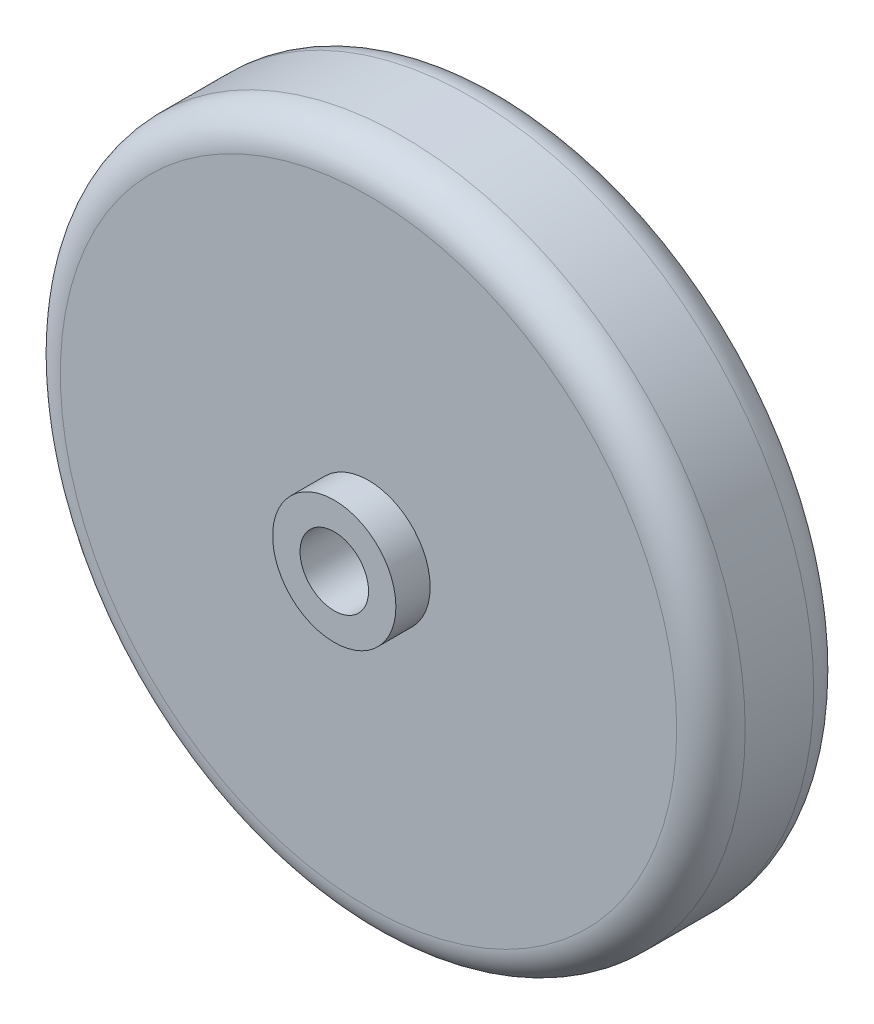
from build123d import *

# Parameters (mm, degrees)
SKETCH1_R           = 50
BOSS_EXTRUDE1_DEPTH = 20
SKETCH2_R           = 9
BOSS_EXTRUDE2_DEPTH = 5
CUT_EXTRUDE4_DEPTH  = 10
CHAMFER2_SIZE       = 2
FILLET1_R           = 5
SKETCH5_R           = 5
CUT_EXTRUDE5_DEPTH  = 15


with BuildPart() as part:
    # Sketch1 → Boss-Extrude1 (new body)
    with BuildSketch(Plane.XY):
        Circle(SKETCH1_R)
    extrude(amount=BOSS_EXTRUDE1_DEPTH)

    # Sketch2 → Boss-Extrude2 (add)
    with BuildSketch(Plane.XY.offset(20)):
        Circle(SKETCH2_R)
    extrude(amount=BOSS_EXTRUDE2_DEPTH)

    # Sketch3 → Cut-Extrude4 (cut)
    with BuildSketch(Plane(origin=(0, 0, 0), x_dir=(-1, 0, 0), z_dir=(0, 0, -1))):
        with BuildLine():
            Line((-36.97118964, 15.26863244), (-5.877852523, 8.090169944))
            Line((-5.877852523, 8.090169944), (-23.511410092, 32.360679775))
            ThreePointArc((-23.511410092, 32.360679775), (-31.425638229, 24.747308175), (-36.97118964, 15.26863244))
        make_face()
        with BuildLine():
            Line((-23.511410092, 32.360679775), (-5.877852523, 8.090169944))
            Line((-5.877852523, 8.090169944), (-3.096606476, 39.879957727))
            ThreePointArc((-3.096606476, 39.879957727), (-13.825032428, 37.534896808), (-23.511410092, 32.360679775))
        make_face()
        with BuildLine():
            Line((3.096606476, 39.879957727), (5.877852523, 8.090169944))
            Line((5.877852523, 8.090169944), (23.511410092, 32.360679775))
            ThreePointArc((23.511410092, 32.360679775), (13.825032428, 37.534896808), (3.096606476, 39.879957727))
        make_face()
        with BuildLine():
            Line((23.511410092, 32.360679775), (5.877852523, 8.090169944))
            Line((5.877852523, 8.090169944), (36.97118964, 15.26863244))
            ThreePointArc((36.97118964, 15.26863244), (31.425638229, 24.747308175), (23.511410092, 32.360679775))
        make_face()
        with BuildLine():
            Line((38.884997692, 9.378536905), (9.510565163, -3.090169944))
            Line((9.510565163, -3.090169944), (38.042260652, -12.360679775))
            ThreePointArc((38.042260652, -12.360679775), (39.507533624, -6.257378602), (40, 0))
            ThreePointArc((40, 0), (39.720271321, 4.722292468), (38.884997692, 9.378536905))
        make_face()
        with BuildLine():
            Line((38.042260652, -12.360679775), (9.510565163, -3.090169944))
            Line((9.510565163, -3.090169944), (25.946058278, -30.443423918))
            ThreePointArc((25.946058278, -30.443423918), (33.247144972, -22.240219226), (38.042260652, -12.360679775))
        make_face()
        with BuildLine():
            Line((20.93564375, -34.083703155), (0, -10))
            Line((0, -10), (0, -40))
            ThreePointArc((0, -40), (10.877772607, -38.492519573), (20.93564375, -34.083703155))
        make_face()
        with BuildLine():
            Line((0, -40), (0, -10))
            Line((0, -10), (-20.93564375, -34.083703155))
            ThreePointArc((-20.93564375, -34.083703155), (-10.877772607, -38.492519573), (0, -40))
        make_face()
        with BuildLine():
            Line((-25.946058278, -30.443423918), (-9.510565163, -3.090169944))
            Line((-9.510565163, -3.090169944), (-38.042260652, -12.360679775))
            ThreePointArc((-38.042260652, -12.360679775), (-33.247144972, -22.240219226), (-25.946058278, -30.443423918))
        make_face()
        with BuildLine():
            Line((-38.042260652, -12.360679775), (-9.510565163, -3.090169944))
            Line((-9.510565163, -3.090169944), (-38.884997692, 9.378536905))
            ThreePointArc((-38.884997692, 9.378536905), (-39.969978165, -1.549466183), (-38.042260652, -12.360679775))
        make_face()
    extrude(amount=-CUT_EXTRUDE4_DEPTH, mode=Mode.SUBTRACT)

    # Chamfer2
    chamfer2_edges = [part.edges().sort_by_distance(p)[0] for p in [
        (-24.197781428, 3.144183481, 0),
        (-17.728311721, -16.766796931, 0),
        (-4.487229499, 23.985063836, 0),
        (-21.424521082, 11.679401192, 0),
        (17.728311721, -16.766796931, 0),
        (24.197781428, 3.144183481, 0),
        (-10.467821875, -22.041851578, 0),
        (10.467821875, -22.041851578, 0),
        (21.424521082, 11.679401192, 0),
        (4.487229499, 23.985063836, 0),
    ]]
    chamfer(chamfer2_edges, length=CHAMFER2_SIZE)

    # Fillet1
    # the kernel refuses this fillet: 5 mm, written as the material it takes off along each edge
    with BuildSketch(Plane(origin=(0, 0, 0), x_dir=(0.33607060875046735, -0.9418367936824779, 0), z_dir=(-0.9418367936824779, -0.33607060875046735, 0))) as fillet1_piece_1_section:
        with BuildLine():
            CenterArc((40 + FILLET1_R, FILLET1_R), FILLET1_R, 180, 90)
            Line((40, FILLET1_R), (40, 0))
            Line((40, 0), (40 + FILLET1_R, 0))
        make_face()
    fillet1_piece_1 = revolve(axis=Axis((0, 0, 0), (0, 0, 1)), revolution_arc=104.724691482, mode=Mode.PRIVATE)
    fillet1_piece_1 = split(fillet1_piece_1, bisect_by=Plane(origin=(-4.951340344, -4.304134495, 0), z_dir=(-0.7547095802227719, -0.6560590289905075, 0)), keep=Keep.TOP, mode=Mode.PRIVATE)
    add(fillet1_piece_1, mode=Mode.SUBTRACT)
    with BuildSketch(Plane(origin=(0, 0, 0), x_dir=(0.33607060875046735, -0.9418367936824779, 0), z_dir=(-0.9418367936824779, -0.33607060875046735, 0))) as fillet1_piece_2_section:
        with BuildLine():
            CenterArc((40 + FILLET1_R, FILLET1_R), FILLET1_R, 180, 90)
            Line((40, FILLET1_R), (40, 0))
            Line((40, 0), (40 + FILLET1_R, 0))
        make_face()
    fillet1_piece_2 = revolve(axis=Axis((0, 0, 0), (0, 0, 1)), revolution_arc=104.724691482, mode=Mode.PRIVATE)
    fillet1_piece_2 = split(fillet1_piece_2, bisect_by=Plane(origin=(-1.720960592, -1.496008219, -2.280295145), z_dir=(-0.5336602620019746, -0.4639037882578497, -0.7071067811865477)), keep=Keep.TOP, mode=Mode.PRIVATE)
    add(fillet1_piece_2, mode=Mode.SUBTRACT)
    with BuildSketch(Plane(origin=(0, 0, 0), x_dir=(0.33607060875046735, -0.9418367936824779, 0), z_dir=(-0.9418367936824779, -0.33607060875046735, 0))) as fillet1_piece_3_section:
        with BuildLine():
            CenterArc((40 + FILLET1_R, FILLET1_R), FILLET1_R, 180, 90)
            Line((40, FILLET1_R), (40, 0))
            Line((40, 0), (40 + FILLET1_R, 0))
        make_face()
    fillet1_piece_3 = revolve(axis=Axis((0, 0, 0), (0, 0, 1)), revolution_arc=104.724691482, mode=Mode.PRIVATE)
    fillet1_piece_3 = split(fillet1_piece_3, bisect_by=Plane(origin=(2.563426848, -6.039055203, 0), z_dir=(0.3907311284892775, -0.9205048534524388, 0)), keep=Keep.TOP, mode=Mode.PRIVATE)
    fillet1_piece_3 = split(fillet1_piece_3, bisect_by=Plane(origin=(5.62352347, 3.378953793, 0), z_dir=(0.8571673007021122, 0.5150380749100543, 0)), keep=Keep.TOP, mode=Mode.PRIVATE)
    add(fillet1_piece_3, mode=Mode.SUBTRACT)
    with BuildSketch(Plane(origin=(0, 0, 0), x_dir=(0.33607060875046735, -0.9418367936824779, 0), z_dir=(-0.9418367936824779, -0.33607060875046735, 0))) as fillet1_piece_4_section:
        with BuildLine():
            CenterArc((40 + FILLET1_R, FILLET1_R), FILLET1_R, 180, 90)
            Line((40, FILLET1_R), (40, 0))
            Line((40, 0), (40 + FILLET1_R, 0))
        make_face()
    fillet1_piece_4 = revolve(axis=Axis((0, 0, 0), (0, 0, 1)), revolution_arc=104.724691482, mode=Mode.PRIVATE)
    fillet1_piece_4 = split(fillet1_piece_4, bisect_by=Plane(origin=(0.890982295, -2.099022748, -2.280295145), z_dir=(0.2762886305754404, -0.6508952239913486, -0.7071067811865477)), keep=Keep.TOP, mode=Mode.PRIVATE)
    fillet1_piece_4 = split(fillet1_piece_4, bisect_by=Plane(origin=(1.954594434, 1.174438822, -2.280295145), z_dir=(0.6061088109378321, 0.36418691533816455, -0.7071067811865476)), keep=Keep.TOP, mode=Mode.PRIVATE)
    add(fillet1_piece_4, mode=Mode.SUBTRACT)
    with BuildSketch(Plane(origin=(0, 0, 0), x_dir=(0.33607060875046735, -0.9418367936824779, 0), z_dir=(-0.9418367936824779, -0.33607060875046735, 0))) as fillet1_piece_5_section:
        with BuildLine():
            CenterArc((40 + FILLET1_R, FILLET1_R), FILLET1_R, 180, 90)
            Line((40, FILLET1_R), (40, 0))
            Line((40, 0), (40 + FILLET1_R, 0))
        make_face()
    fillet1_piece_5 = revolve(axis=Axis((0, 0, 0), (0, 0, 1)), revolution_arc=104.724691482, mode=Mode.PRIVATE)
    fillet1_piece_5 = split(fillet1_piece_5, bisect_by=Plane(origin=(-1.475811703, 6.392442786, 0), z_dir=(-0.22495105434386392, 0.9743700647852355, 0)), keep=Keep.TOP, mode=Mode.PRIVATE)
    add(fillet1_piece_5, mode=Mode.SUBTRACT)
    with BuildSketch(Plane(origin=(0, 0, 0), x_dir=(0.33607060875046735, -0.9418367936824779, 0), z_dir=(-0.9418367936824779, -0.33607060875046735, 0))) as fillet1_piece_6_section:
        with BuildLine():
            CenterArc((40 + FILLET1_R, FILLET1_R), FILLET1_R, 180, 90)
            Line((40, FILLET1_R), (40, 0))
            Line((40, 0), (40 + FILLET1_R, 0))
        make_face()
    fillet1_piece_6 = revolve(axis=Axis((0, 0, 0), (0, 0, 1)), revolution_arc=104.724691482, mode=Mode.PRIVATE)
    fillet1_piece_6 = split(fillet1_piece_6, bisect_by=Plane(origin=(-0.512954797, 2.221851328, -2.280295145), z_dir=(-0.15906441596160978, 0.6889836801948155, -0.7071067811865477)), keep=Keep.TOP, mode=Mode.PRIVATE)
    add(fillet1_piece_6, mode=Mode.SUBTRACT)
    with BuildSketch(Plane(origin=(0, 0, 0), x_dir=(-0.7918884905044262, -0.610665717562908, 0), z_dir=(-0.610665717562908, 0.7918884905044262, 0))) as fillet1_piece_7_section:
        with BuildLine():
            CenterArc((40 + FILLET1_R, FILLET1_R), FILLET1_R, 180, 90)
            Line((40, FILLET1_R), (40, 0))
            Line((40, 0), (40 + FILLET1_R, 0))
        make_face()
    fillet1_piece_7 = revolve(axis=Axis((0, 0, 0), (0, 0, 1)), revolution_arc=104.724691482, mode=Mode.PRIVATE)
    fillet1_piece_7 = split(fillet1_piece_7, bisect_by=Plane(origin=(-5.62352347, 3.378953793, 0), z_dir=(-0.8571673007021121, 0.5150380749100545, 0)), keep=Keep.TOP, mode=Mode.PRIVATE)
    add(fillet1_piece_7, mode=Mode.SUBTRACT)
    with BuildSketch(Plane(origin=(0, 0, 0), x_dir=(-0.7918884905044262, -0.610665717562908, 0), z_dir=(-0.610665717562908, 0.7918884905044262, 0))) as fillet1_piece_8_section:
        with BuildLine():
            CenterArc((40 + FILLET1_R, FILLET1_R), FILLET1_R, 180, 90)
            Line((40, FILLET1_R), (40, 0))
            Line((40, 0), (40 + FILLET1_R, 0))
        make_face()
    fillet1_piece_8 = revolve(axis=Axis((0, 0, 0), (0, 0, 1)), revolution_arc=104.724691482, mode=Mode.PRIVATE)
    fillet1_piece_8 = split(fillet1_piece_8, bisect_by=Plane(origin=(-1.954594434, 1.174438822, -2.280295145), z_dir=(-0.6061088109378319, 0.3641869153381646, -0.7071067811865477)), keep=Keep.TOP, mode=Mode.PRIVATE)
    add(fillet1_piece_8, mode=Mode.SUBTRACT)
    with BuildSketch(Plane(origin=(0, 0, 0), x_dir=(-0.7918884905044262, -0.610665717562908, 0), z_dir=(-0.610665717562908, 0.7918884905044262, 0))) as fillet1_piece_9_section:
        with BuildLine():
            CenterArc((40 + FILLET1_R, FILLET1_R), FILLET1_R, 180, 90)
            Line((40, FILLET1_R), (40, 0))
            Line((40, 0), (40 + FILLET1_R, 0))
        make_face()
    fillet1_piece_9 = revolve(axis=Axis((0, 0, 0), (0, 0, 1)), revolution_arc=104.724691482, mode=Mode.PRIVATE)
    fillet1_piece_9 = split(fillet1_piece_9, bisect_by=Plane(origin=(-4.951340344, -4.304134495, 0), z_dir=(-0.7547095802227719, -0.6560590289905075, 0)), keep=Keep.TOP, mode=Mode.PRIVATE)
    fillet1_piece_9 = split(fillet1_piece_9, bisect_by=Plane(origin=(4.951340344, -4.304134495, 0), z_dir=(0.7547095802227719, -0.6560590289905074, 0)), keep=Keep.TOP, mode=Mode.PRIVATE)
    add(fillet1_piece_9, mode=Mode.SUBTRACT)
    with BuildSketch(Plane(origin=(0, 0, 0), x_dir=(-0.7918884905044262, -0.610665717562908, 0), z_dir=(-0.610665717562908, 0.7918884905044262, 0))) as fillet1_piece_10_section:
        with BuildLine():
            CenterArc((40 + FILLET1_R, FILLET1_R), FILLET1_R, 180, 90)
            Line((40, FILLET1_R), (40, 0))
            Line((40, 0), (40 + FILLET1_R, 0))
        make_face()
    fillet1_piece_10 = revolve(axis=Axis((0, 0, 0), (0, 0, 1)), revolution_arc=104.724691482, mode=Mode.PRIVATE)
    fillet1_piece_10 = split(fillet1_piece_10, bisect_by=Plane(origin=(-1.720960592, -1.496008219, -2.280295145), z_dir=(-0.5336602620019746, -0.4639037882578497, -0.7071067811865477)), keep=Keep.TOP, mode=Mode.PRIVATE)
    fillet1_piece_10 = split(fillet1_piece_10, bisect_by=Plane(origin=(1.720960592, -1.496008219, -2.280295145), z_dir=(0.5336602620019747, -0.46390378825784945, -0.7071067811865477)), keep=Keep.TOP, mode=Mode.PRIVATE)
    add(fillet1_piece_10, mode=Mode.SUBTRACT)
    with BuildSketch(Plane(origin=(0, 0, 0), x_dir=(-0.7918884905044262, -0.610665717562908, 0), z_dir=(-0.610665717562908, 0.7918884905044262, 0))) as fillet1_piece_11_section:
        with BuildLine():
            CenterArc((40 + FILLET1_R, FILLET1_R), FILLET1_R, 180, 90)
            Line((40, FILLET1_R), (40, 0))
            Line((40, 0), (40 + FILLET1_R, 0))
        make_face()
    fillet1_piece_11 = revolve(axis=Axis((0, 0, 0), (0, 0, 1)), revolution_arc=104.724691482, mode=Mode.PRIVATE)
    fillet1_piece_11 = split(fillet1_piece_11, bisect_by=Plane(origin=(5.62352347, 3.378953793, 0), z_dir=(0.8571673007021122, 0.5150380749100543, 0)), keep=Keep.TOP, mode=Mode.PRIVATE)
    add(fillet1_piece_11, mode=Mode.SUBTRACT)
    with BuildSketch(Plane(origin=(0, 0, 0), x_dir=(-0.7918884905044262, -0.610665717562908, 0), z_dir=(-0.610665717562908, 0.7918884905044262, 0))) as fillet1_piece_12_section:
        with BuildLine():
            CenterArc((40 + FILLET1_R, FILLET1_R), FILLET1_R, 180, 90)
            Line((40, FILLET1_R), (40, 0))
            Line((40, 0), (40 + FILLET1_R, 0))
        make_face()
    fillet1_piece_12 = revolve(axis=Axis((0, 0, 0), (0, 0, 1)), revolution_arc=104.724691482, mode=Mode.PRIVATE)
    fillet1_piece_12 = split(fillet1_piece_12, bisect_by=Plane(origin=(1.954594434, 1.174438822, -2.280295145), z_dir=(0.6061088109378321, 0.36418691533816455, -0.7071067811865476)), keep=Keep.TOP, mode=Mode.PRIVATE)
    add(fillet1_piece_12, mode=Mode.SUBTRACT)
    with BuildSketch(Plane(origin=(0, 0, 0), x_dir=(-0.8254846111820394, 0.5644246244642743, 0), z_dir=(0.5644246244642743, 0.8254846111820394, 0))) as fillet1_piece_13_section:
        with BuildLine():
            CenterArc((40 + FILLET1_R, FILLET1_R), FILLET1_R, 180, 90)
            Line((40, FILLET1_R), (40, 0))
            Line((40, 0), (40 + FILLET1_R, 0))
        make_face()
    fillet1_piece_13 = revolve(axis=Axis((0, 0, 0), (0, 0, 1)), revolution_arc=104.724691482, mode=Mode.PRIVATE)
    fillet1_piece_13 = split(fillet1_piece_13, bisect_by=Plane(origin=(1.475811703, 6.392442786, 0), z_dir=(0.2249510543438882, 0.9743700647852299, 0)), keep=Keep.TOP, mode=Mode.PRIVATE)
    add(fillet1_piece_13, mode=Mode.SUBTRACT)
    with BuildSketch(Plane(origin=(0, 0, 0), x_dir=(-0.8254846111820394, 0.5644246244642743, 0), z_dir=(0.5644246244642743, 0.8254846111820394, 0))) as fillet1_piece_14_section:
        with BuildLine():
            CenterArc((40 + FILLET1_R, FILLET1_R), FILLET1_R, 180, 90)
            Line((40, FILLET1_R), (40, 0))
            Line((40, 0), (40 + FILLET1_R, 0))
        make_face()
    fillet1_piece_14 = revolve(axis=Axis((0, 0, 0), (0, 0, 1)), revolution_arc=104.724691482, mode=Mode.PRIVATE)
    fillet1_piece_14 = split(fillet1_piece_14, bisect_by=Plane(origin=(0.512954797, 2.221851328, -2.280295145), z_dir=(0.15906441596162676, 0.6889836801948115, -0.7071067811865477)), keep=Keep.TOP, mode=Mode.PRIVATE)
    add(fillet1_piece_14, mode=Mode.SUBTRACT)
    with BuildSketch(Plane(origin=(0, 0, 0), x_dir=(-0.8254846111820394, 0.5644246244642743, 0), z_dir=(0.5644246244642743, 0.8254846111820394, 0))) as fillet1_piece_15_section:
        with BuildLine():
            CenterArc((40 + FILLET1_R, FILLET1_R), FILLET1_R, 180, 90)
            Line((40, FILLET1_R), (40, 0))
            Line((40, 0), (40 + FILLET1_R, 0))
        make_face()
    fillet1_piece_15 = revolve(axis=Axis((0, 0, 0), (0, 0, 1)), revolution_arc=104.724691482, mode=Mode.PRIVATE)
    fillet1_piece_15 = split(fillet1_piece_15, bisect_by=Plane(origin=(-5.62352347, 3.378953793, 0), z_dir=(-0.8571673007021121, 0.5150380749100545, 0)), keep=Keep.TOP, mode=Mode.PRIVATE)
    fillet1_piece_15 = split(fillet1_piece_15, bisect_by=Plane(origin=(-2.563426848, -6.039055203, 0), z_dir=(-0.39073112848929537, -0.9205048534524312, 0)), keep=Keep.TOP, mode=Mode.PRIVATE)
    add(fillet1_piece_15, mode=Mode.SUBTRACT)
    with BuildSketch(Plane(origin=(0, 0, 0), x_dir=(-0.8254846111820394, 0.5644246244642743, 0), z_dir=(0.5644246244642743, 0.8254846111820394, 0))) as fillet1_piece_16_section:
        with BuildLine():
            CenterArc((40 + FILLET1_R, FILLET1_R), FILLET1_R, 180, 90)
            Line((40, FILLET1_R), (40, 0))
            Line((40, 0), (40 + FILLET1_R, 0))
        make_face()
    fillet1_piece_16 = revolve(axis=Axis((0, 0, 0), (0, 0, 1)), revolution_arc=104.724691482, mode=Mode.PRIVATE)
    fillet1_piece_16 = split(fillet1_piece_16, bisect_by=Plane(origin=(-1.954594434, 1.174438822, -2.280295145), z_dir=(-0.6061088109378319, 0.3641869153381646, -0.7071067811865477)), keep=Keep.TOP, mode=Mode.PRIVATE)
    fillet1_piece_16 = split(fillet1_piece_16, bisect_by=Plane(origin=(-0.890982295, -2.099022748, -2.280295145), z_dir=(-0.2762886305754528, -0.650895223991343, -0.7071067811865479)), keep=Keep.TOP, mode=Mode.PRIVATE)
    add(fillet1_piece_16, mode=Mode.SUBTRACT)
    with BuildSketch(Plane(origin=(0, 0, 0), x_dir=(-0.8254846111820394, 0.5644246244642743, 0), z_dir=(0.5644246244642743, 0.8254846111820394, 0))) as fillet1_piece_17_section:
        with BuildLine():
            CenterArc((40 + FILLET1_R, FILLET1_R), FILLET1_R, 180, 90)
            Line((40, FILLET1_R), (40, 0))
            Line((40, 0), (40 + FILLET1_R, 0))
        make_face()
    fillet1_piece_17 = revolve(axis=Axis((0, 0, 0), (0, 0, 1)), revolution_arc=104.724691482, mode=Mode.PRIVATE)
    fillet1_piece_17 = split(fillet1_piece_17, bisect_by=Plane(origin=(4.951340344, -4.304134495, 0), z_dir=(0.7547095802227719, -0.6560590289905074, 0)), keep=Keep.TOP, mode=Mode.PRIVATE)
    add(fillet1_piece_17, mode=Mode.SUBTRACT)
    with BuildSketch(Plane(origin=(0, 0, 0), x_dir=(-0.8254846111820394, 0.5644246244642743, 0), z_dir=(0.5644246244642743, 0.8254846111820394, 0))) as fillet1_piece_18_section:
        with BuildLine():
            CenterArc((40 + FILLET1_R, FILLET1_R), FILLET1_R, 180, 90)
            Line((40, FILLET1_R), (40, 0))
            Line((40, 0), (40 + FILLET1_R, 0))
        make_face()
    fillet1_piece_18 = revolve(axis=Axis((0, 0, 0), (0, 0, 1)), revolution_arc=104.724691482, mode=Mode.PRIVATE)
    fillet1_piece_18 = split(fillet1_piece_18, bisect_by=Plane(origin=(1.720960592, -1.496008219, -2.280295145), z_dir=(0.5336602620019747, -0.46390378825784945, -0.7071067811865477)), keep=Keep.TOP, mode=Mode.PRIVATE)
    add(fillet1_piece_18, mode=Mode.SUBTRACT)
    with BuildSketch(Plane(origin=(0, 0, 0), x_dir=(0.2817109436039243, 0.959499319569215, 0), z_dir=(0.959499319569215, -0.2817109436039243, 0))) as fillet1_piece_19_section:
        with BuildLine():
            CenterArc((40 + FILLET1_R, FILLET1_R), FILLET1_R, 180, 90)
            Line((40, FILLET1_R), (40, 0))
            Line((40, 0), (40 + FILLET1_R, 0))
        make_face()
    fillet1_piece_19 = revolve(axis=Axis((0, 0, 0), (0, 0, 1)), revolution_arc=104.724691482, mode=Mode.PRIVATE)
    fillet1_piece_19 = split(fillet1_piece_19, bisect_by=Plane(origin=(6.535625263, 0.57179312, 0), z_dir=(0.9961946980917454, 0.08715574274765994, 0)), keep=Keep.TOP, mode=Mode.PRIVATE)
    add(fillet1_piece_19, mode=Mode.SUBTRACT)
    with BuildSketch(Plane(origin=(0, 0, 0), x_dir=(0.2817109436039243, 0.959499319569215, 0), z_dir=(0.959499319569215, -0.2817109436039243, 0))) as fillet1_piece_20_section:
        with BuildLine():
            CenterArc((40 + FILLET1_R, FILLET1_R), FILLET1_R, 180, 90)
            Line((40, FILLET1_R), (40, 0))
            Line((40, 0), (40 + FILLET1_R, 0))
        make_face()
    fillet1_piece_20 = revolve(axis=Axis((0, 0, 0), (0, 0, 1)), revolution_arc=104.724691482, mode=Mode.PRIVATE)
    fillet1_piece_20 = split(fillet1_piece_20, bisect_by=Plane(origin=(2.271617933, 0.198740817, -2.280295145), z_dir=(0.7044160264027587, 0.0616284167162206, -0.7071067811865476)), keep=Keep.TOP, mode=Mode.PRIVATE)
    add(fillet1_piece_20, mode=Mode.SUBTRACT)
    with BuildSketch(Plane(origin=(0, 0, 0), x_dir=(0.2817109436039243, 0.959499319569215, 0), z_dir=(0.959499319569215, -0.2817109436039243, 0))) as fillet1_piece_21_section:
        with BuildLine():
            CenterArc((40 + FILLET1_R, FILLET1_R), FILLET1_R, 180, 90)
            Line((40, FILLET1_R), (40, 0))
            Line((40, 0), (40 + FILLET1_R, 0))
        make_face()
    fillet1_piece_21 = revolve(axis=Axis((0, 0, 0), (0, 0, 1)), revolution_arc=104.724691482, mode=Mode.PRIVATE)
    fillet1_piece_21 = split(fillet1_piece_21, bisect_by=Plane(origin=(1.475811703, 6.392442786, 0), z_dir=(0.2249510543438882, 0.9743700647852299, 0)), keep=Keep.TOP, mode=Mode.PRIVATE)
    fillet1_piece_21 = split(fillet1_piece_21, bisect_by=Plane(origin=(-6.535625263, 0.57179312, 0), z_dir=(-0.9961946980917457, 0.08715574274765678, 0)), keep=Keep.TOP, mode=Mode.PRIVATE)
    add(fillet1_piece_21, mode=Mode.SUBTRACT)
    with BuildSketch(Plane(origin=(0, 0, 0), x_dir=(0.2817109436039243, 0.959499319569215, 0), z_dir=(0.959499319569215, -0.2817109436039243, 0))) as fillet1_piece_22_section:
        with BuildLine():
            CenterArc((40 + FILLET1_R, FILLET1_R), FILLET1_R, 180, 90)
            Line((40, FILLET1_R), (40, 0))
            Line((40, 0), (40 + FILLET1_R, 0))
        make_face()
    fillet1_piece_22 = revolve(axis=Axis((0, 0, 0), (0, 0, 1)), revolution_arc=104.724691482, mode=Mode.PRIVATE)
    fillet1_piece_22 = split(fillet1_piece_22, bisect_by=Plane(origin=(0.512954797, 2.221851328, -2.280295145), z_dir=(0.15906441596162676, 0.6889836801948115, -0.7071067811865477)), keep=Keep.TOP, mode=Mode.PRIVATE)
    fillet1_piece_22 = split(fillet1_piece_22, bisect_by=Plane(origin=(-2.271617933, 0.198740817, -2.280295145), z_dir=(-0.7044160264027588, 0.06162841671621832, -0.7071067811865476)), keep=Keep.TOP, mode=Mode.PRIVATE)
    add(fillet1_piece_22, mode=Mode.SUBTRACT)
    with BuildSketch(Plane(origin=(0, 0, 0), x_dir=(0.2817109436039243, 0.959499319569215, 0), z_dir=(0.959499319569215, -0.2817109436039243, 0))) as fillet1_piece_23_section:
        with BuildLine():
            CenterArc((40 + FILLET1_R, FILLET1_R), FILLET1_R, 180, 90)
            Line((40, FILLET1_R), (40, 0))
            Line((40, 0), (40 + FILLET1_R, 0))
        make_face()
    fillet1_piece_23 = revolve(axis=Axis((0, 0, 0), (0, 0, 1)), revolution_arc=104.724691482, mode=Mode.PRIVATE)
    fillet1_piece_23 = split(fillet1_piece_23, bisect_by=Plane(origin=(-2.563426848, -6.039055203, 0), z_dir=(-0.39073112848929537, -0.9205048534524312, 0)), keep=Keep.TOP, mode=Mode.PRIVATE)
    add(fillet1_piece_23, mode=Mode.SUBTRACT)
    with BuildSketch(Plane(origin=(0, 0, 0), x_dir=(0.2817109436039243, 0.959499319569215, 0), z_dir=(0.959499319569215, -0.2817109436039243, 0))) as fillet1_piece_24_section:
        with BuildLine():
            CenterArc((40 + FILLET1_R, FILLET1_R), FILLET1_R, 180, 90)
            Line((40, FILLET1_R), (40, 0))
            Line((40, 0), (40 + FILLET1_R, 0))
        make_face()
    fillet1_piece_24 = revolve(axis=Axis((0, 0, 0), (0, 0, 1)), revolution_arc=104.724691482, mode=Mode.PRIVATE)
    fillet1_piece_24 = split(fillet1_piece_24, bisect_by=Plane(origin=(-0.890982295, -2.099022748, -2.280295145), z_dir=(-0.2762886305754528, -0.650895223991343, -0.7071067811865479)), keep=Keep.TOP, mode=Mode.PRIVATE)
    add(fillet1_piece_24, mode=Mode.SUBTRACT)
    with BuildSketch(Plane(origin=(0, 0, 0), x_dir=(0.9995915493320829, 0.028578567211915915, 0), z_dir=(0.028578567211915915, -0.9995915493320829, 0))) as fillet1_piece_25_section:
        with BuildLine():
            CenterArc((40 + FILLET1_R, FILLET1_R), FILLET1_R, 180, 90)
            Line((40, FILLET1_R), (40, 0))
            Line((40, 0), (40 + FILLET1_R, 0))
        make_face()
    fillet1_piece_25 = revolve(axis=Axis((0, 0, 0), (0, 0, 1)), revolution_arc=104.724691482, mode=Mode.PRIVATE)
    fillet1_piece_25 = split(fillet1_piece_25, bisect_by=Plane(origin=(2.563426848, -6.039055203, 0), z_dir=(0.3907311284892775, -0.9205048534524388, 0)), keep=Keep.TOP, mode=Mode.PRIVATE)
    add(fillet1_piece_25, mode=Mode.SUBTRACT)
    with BuildSketch(Plane(origin=(0, 0, 0), x_dir=(0.9995915493320829, 0.028578567211915915, 0), z_dir=(0.028578567211915915, -0.9995915493320829, 0))) as fillet1_piece_26_section:
        with BuildLine():
            CenterArc((40 + FILLET1_R, FILLET1_R), FILLET1_R, 180, 90)
            Line((40, FILLET1_R), (40, 0))
            Line((40, 0), (40 + FILLET1_R, 0))
        make_face()
    fillet1_piece_26 = revolve(axis=Axis((0, 0, 0), (0, 0, 1)), revolution_arc=104.724691482, mode=Mode.PRIVATE)
    fillet1_piece_26 = split(fillet1_piece_26, bisect_by=Plane(origin=(0.890982295, -2.099022748, -2.280295145), z_dir=(0.2762886305754404, -0.6508952239913486, -0.7071067811865477)), keep=Keep.TOP, mode=Mode.PRIVATE)
    add(fillet1_piece_26, mode=Mode.SUBTRACT)
    with BuildSketch(Plane(origin=(0, 0, 0), x_dir=(0.9995915493320829, 0.028578567211915915, 0), z_dir=(0.028578567211915915, -0.9995915493320829, 0))) as fillet1_piece_27_section:
        with BuildLine():
            CenterArc((40 + FILLET1_R, FILLET1_R), FILLET1_R, 180, 90)
            Line((40, FILLET1_R), (40, 0))
            Line((40, 0), (40 + FILLET1_R, 0))
        make_face()
    fillet1_piece_27 = revolve(axis=Axis((0, 0, 0), (0, 0, 1)), revolution_arc=104.724691482, mode=Mode.PRIVATE)
    fillet1_piece_27 = split(fillet1_piece_27, bisect_by=Plane(origin=(6.535625263, 0.57179312, 0), z_dir=(0.9961946980917454, 0.08715574274765994, 0)), keep=Keep.TOP, mode=Mode.PRIVATE)
    fillet1_piece_27 = split(fillet1_piece_27, bisect_by=Plane(origin=(-1.475811703, 6.392442786, 0), z_dir=(-0.22495105434386392, 0.9743700647852355, 0)), keep=Keep.TOP, mode=Mode.PRIVATE)
    add(fillet1_piece_27, mode=Mode.SUBTRACT)
    with BuildSketch(Plane(origin=(0, 0, 0), x_dir=(0.9995915493320829, 0.028578567211915915, 0), z_dir=(0.028578567211915915, -0.9995915493320829, 0))) as fillet1_piece_28_section:
        with BuildLine():
            CenterArc((40 + FILLET1_R, FILLET1_R), FILLET1_R, 180, 90)
            Line((40, FILLET1_R), (40, 0))
            Line((40, 0), (40 + FILLET1_R, 0))
        make_face()
    fillet1_piece_28 = revolve(axis=Axis((0, 0, 0), (0, 0, 1)), revolution_arc=104.724691482, mode=Mode.PRIVATE)
    fillet1_piece_28 = split(fillet1_piece_28, bisect_by=Plane(origin=(2.271617933, 0.198740817, -2.280295145), z_dir=(0.7044160264027587, 0.0616284167162206, -0.7071067811865476)), keep=Keep.TOP, mode=Mode.PRIVATE)
    fillet1_piece_28 = split(fillet1_piece_28, bisect_by=Plane(origin=(-0.512954797, 2.221851328, -2.280295145), z_dir=(-0.15906441596160978, 0.6889836801948155, -0.7071067811865477)), keep=Keep.TOP, mode=Mode.PRIVATE)
    add(fillet1_piece_28, mode=Mode.SUBTRACT)
    with BuildSketch(Plane(origin=(0, 0, 0), x_dir=(0.9995915493320829, 0.028578567211915915, 0), z_dir=(0.028578567211915915, -0.9995915493320829, 0))) as fillet1_piece_29_section:
        with BuildLine():
            CenterArc((40 + FILLET1_R, FILLET1_R), FILLET1_R, 180, 90)
            Line((40, FILLET1_R), (40, 0))
            Line((40, 0), (40 + FILLET1_R, 0))
        make_face()
    fillet1_piece_29 = revolve(axis=Axis((0, 0, 0), (0, 0, 1)), revolution_arc=104.724691482, mode=Mode.PRIVATE)
    fillet1_piece_29 = split(fillet1_piece_29, bisect_by=Plane(origin=(-6.535625263, 0.57179312, 0), z_dir=(-0.9961946980917457, 0.08715574274765678, 0)), keep=Keep.TOP, mode=Mode.PRIVATE)
    add(fillet1_piece_29, mode=Mode.SUBTRACT)
    with BuildSketch(Plane(origin=(0, 0, 0), x_dir=(0.9995915493320829, 0.028578567211915915, 0), z_dir=(0.028578567211915915, -0.9995915493320829, 0))) as fillet1_piece_30_section:
        with BuildLine():
            CenterArc((40 + FILLET1_R, FILLET1_R), FILLET1_R, 180, 90)
            Line((40, FILLET1_R), (40, 0))
            Line((40, 0), (40 + FILLET1_R, 0))
        make_face()
    fillet1_piece_30 = revolve(axis=Axis((0, 0, 0), (0, 0, 1)), revolution_arc=104.724691482, mode=Mode.PRIVATE)
    fillet1_piece_30 = split(fillet1_piece_30, bisect_by=Plane(origin=(-2.271617933, 0.198740817, -2.280295145), z_dir=(-0.7044160264027588, 0.06162841671621832, -0.7071067811865476)), keep=Keep.TOP, mode=Mode.PRIVATE)
    add(fillet1_piece_30, mode=Mode.SUBTRACT)

    # Fillet2: read off the stored shape, not the designer's step
    # Fillet2 outline → Fillet2 (revolve, cut)
    with BuildSketch(Plane.XZ):
        with BuildLine():
            ThreePointArc((50, 5), (48.535533906, 1.464466094), (45, 0))
            Line((45, 0), (50, 0))
            Line((50, 0), (50, 5))
        make_face()
        with BuildLine():
            ThreePointArc((45, 20), (48.535533906, 18.535533906), (50, 15))
            Line((50, 15), (50, 20))
            Line((50, 20), (45, 20))
        make_face()
    revolve(axis=Axis((0, 0, 0), (0, 0, 1)), mode=Mode.SUBTRACT)

    # Sketch5 → Cut-Extrude5 (cut)
    with BuildSketch(Plane.XY.offset(25)):
        Circle(SKETCH5_R)
    extrude(amount=-CUT_EXTRUDE5_DEPTH, mode=Mode.SUBTRACT)


solid = part.part
